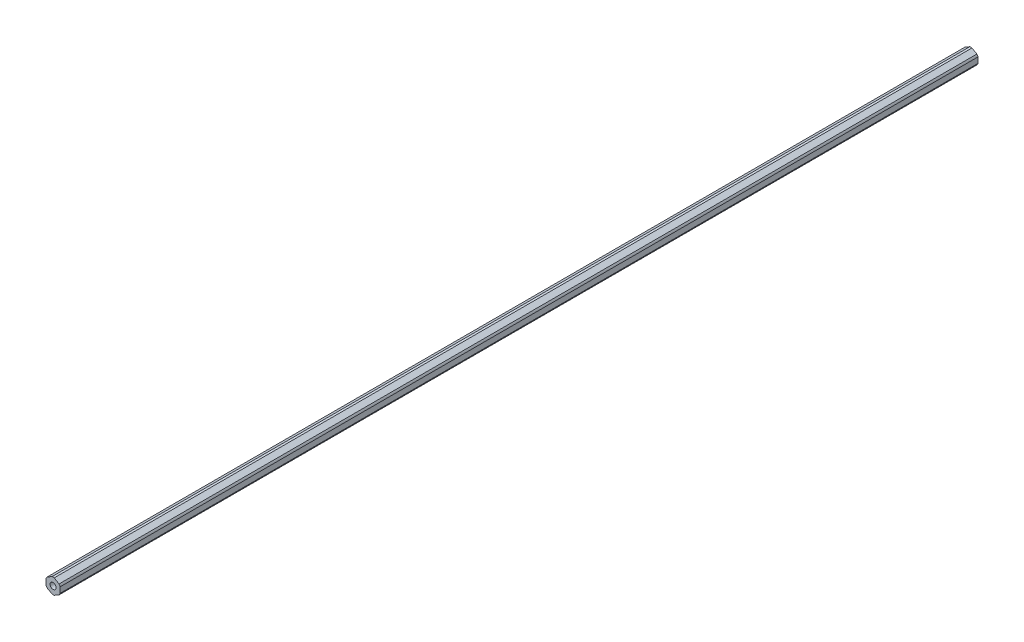
from build123d import *

# Parameters (mm, degrees)
BOSS_EXTRUDE1_DEPTH                  = 307.975
F_10_32_TAPPED_HOLE2_D               = 4.0386
F_10_32_TAPPED_HOLE2_DEPTH           = 16.34744
F_10_32_TAPPED_HOLE2_TIP             = 1.213317848
F_10_32_TAPPED_HOLE2_ON_FACE_2_D     = 4.0386
F_10_32_TAPPED_HOLE2_ON_FACE_2_DEPTH = 16.34744
F_10_32_TAPPED_HOLE2_ON_FACE_2_TIP   = 1.213317848


with BuildPart() as part:
    # Sketch2 → Boss-Extrude1 (new, symmetric)
    with BuildSketch(Plane.XY):
        with BuildLine():
            ThreePointArc((0.741687758, 5.071047688), (0, 5.125000037), (-0.741687758, 5.071047688))
            Line((-0.741687758, 5.071047688), (-4.020812242, 3.177844283))
            ThreePointArc((-4.020812242, 3.177844283), (-4.438380226, 2.562500019), (-4.7625, 1.893203404))
            Line((-4.7625, 1.893203404), (-4.7625, -1.893203404))
            ThreePointArc((-4.7625, -1.893203404), (-4.438380226, -2.562500019), (-4.020812242, -3.177844283))
            Line((-4.020812242, -3.177844283), (-0.741687758, -5.071047688))
            ThreePointArc((-0.741687758, -5.071047688), (0, -5.125000037), (0.741687758, -5.071047688))
            Line((0.741687758, -5.071047688), (4.020812242, -3.177844283))
            ThreePointArc((4.020812242, -3.177844283), (4.438380226, -2.562500019), (4.7625, -1.893203404))
            Line((4.7625, -1.893203404), (4.7625, 1.893203404))
            ThreePointArc((4.7625, 1.893203404), (4.438380226, 2.562500019), (4.020812242, 3.177844283))
            Line((4.020812242, 3.177844283), (0.741687758, 5.071047688))
        make_face()
    extrude(amount=BOSS_EXTRUDE1_DEPTH, both=True)

    # #10-32 Tapped Hole2
    with Locations(Plane.XY.offset(307.975)):
        with Locations((0, 0)):
            Hole(F_10_32_TAPPED_HOLE2_D / 2, depth=F_10_32_TAPPED_HOLE2_DEPTH)
            with Locations((0, 0, -(F_10_32_TAPPED_HOLE2_DEPTH + F_10_32_TAPPED_HOLE2_TIP / 2))):  # 118° drill point
                Cone(0, F_10_32_TAPPED_HOLE2_D / 2, F_10_32_TAPPED_HOLE2_TIP, mode=Mode.SUBTRACT)

    # #10-32 Tapped Hole2 on face 2
    with Locations(Plane(origin=(0, 0, -307.975), x_dir=(-1, 0, 0), z_dir=(0, 0, -1))):
        with Locations((0, 0)):
            Hole(F_10_32_TAPPED_HOLE2_ON_FACE_2_D / 2, depth=F_10_32_TAPPED_HOLE2_ON_FACE_2_DEPTH)
            with Locations((0, 0, -(F_10_32_TAPPED_HOLE2_ON_FACE_2_DEPTH + F_10_32_TAPPED_HOLE2_ON_FACE_2_TIP / 2))):  # 118° drill point
                Cone(0, F_10_32_TAPPED_HOLE2_ON_FACE_2_D / 2, F_10_32_TAPPED_HOLE2_ON_FACE_2_TIP, mode=Mode.SUBTRACT)


solid = part.part
